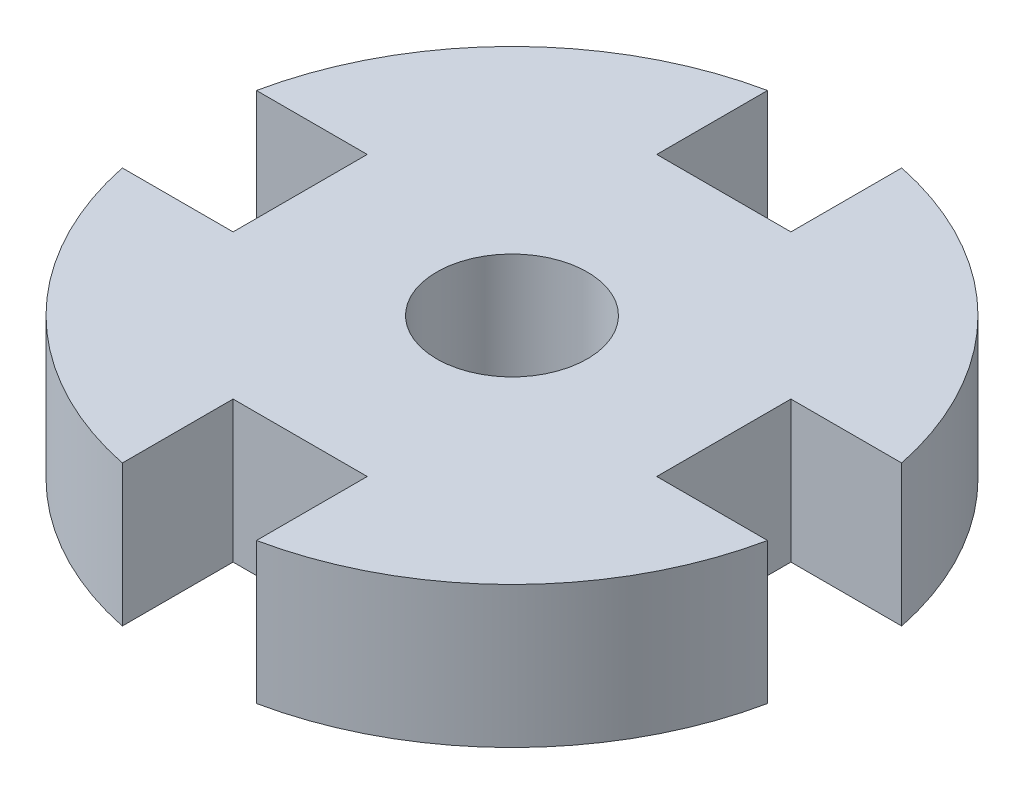
from build123d import *

# Parameters (mm, degrees)
BOSS_EXTRUDE1_DEPTH      = 1.5
BOSS_EXTRUDE1_DEPTH_BACK = 1.5
SKETCH1_R                = 7
SKETCH1_R_2              = 1.6
SKETCH2_W                = 5
SKETCH2_H                = 2.85
CUT_EXTRUDE1_DEPTH       = 11.344080433
CIRPATTERN1_COUNT        = 4


with BuildPart() as part:
    # Sketch1 → Boss-Extrude1 (new, two sides: drawn at the far end of the back side and taken through both)
    with BuildSketch(Plane(origin=(0, 0, 0), x_dir=(1, 0, 0), z_dir=(0, 1, 0)).offset(-BOSS_EXTRUDE1_DEPTH_BACK)):
        Circle(SKETCH1_R)
        Circle(SKETCH1_R_2, mode=Mode.SUBTRACT)
    extrude(amount=BOSS_EXTRUDE1_DEPTH + BOSS_EXTRUDE1_DEPTH_BACK)

    # Sketch2 → Cut-Extrude1 (cut, through all)
    with BuildSketch(Plane(origin=(0, 1.5, 0), x_dir=(1, 0, 0), z_dir=(0, 1, 0))):
        with Locations((7, 0)):
            Rectangle(SKETCH2_W, SKETCH2_H)
    cut_extrude1 = extrude(amount=-CUT_EXTRUDE1_DEPTH, mode=Mode.SUBTRACT)

    # CirPattern1: Cut-Extrude1 ×4 about axis
    cirpattern1_axis = Axis((0, -1.5, 0), (0, 1, 0))
    for i in range(1, CIRPATTERN1_COUNT):
        add(cut_extrude1.rotate(cirpattern1_axis, i * 360 / CIRPATTERN1_COUNT), mode=Mode.SUBTRACT)


solid = part.part
